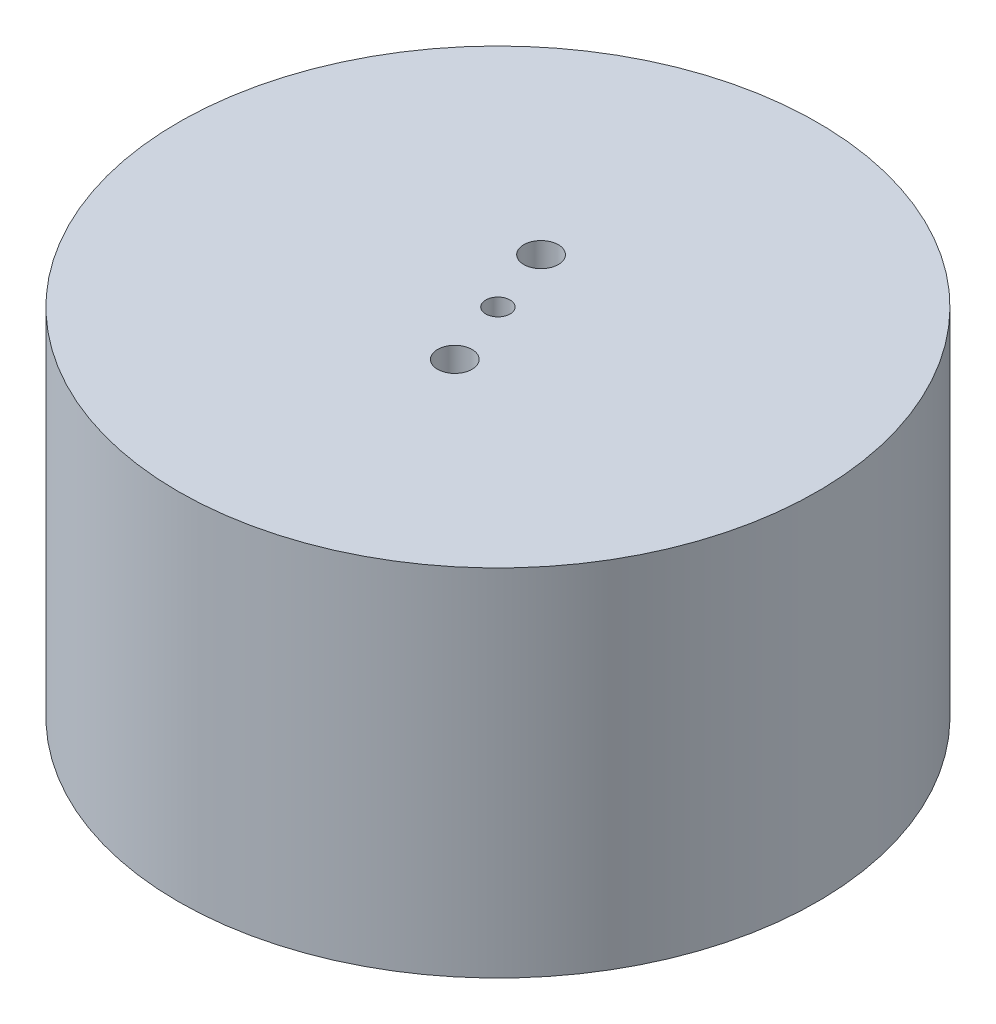
from build123d import *

# Parameters (mm, degrees)
SKETCH4_R                = 31.5
BOSS_EXTRUDE2_DEPTH      = 35
SKETCH3_R                = 26.5
CUT_EXTRUDE1_DEPTH       = 28
M3_CLEARANCE_HOLE1_D     = 3.4
M3_CLEARANCE_HOLE1_DEPTH = 50
M3_CLEARANCE_HOLE1_TIP   = 1.021463052
SKETCH10_R               = 1.2
CUT_EXTRUDE2_DEPTH       = 10


with BuildPart() as part:
    # Sketch4 → Boss-Extrude2 (new body)
    with BuildSketch(Plane(origin=(0, 0, 0), x_dir=(1, 0, 0), z_dir=(0, 1, 0))):
        Circle(SKETCH4_R)
    extrude(amount=BOSS_EXTRUDE2_DEPTH)

    # Sketch3 → Cut-Extrude1 (cut)
    with BuildSketch(Plane(origin=(0, 0, 0), x_dir=(1, 0, 0), z_dir=(0, 1, 0))):
        Circle(SKETCH3_R)
    extrude(amount=CUT_EXTRUDE1_DEPTH, mode=Mode.SUBTRACT)

    # M3 Clearance Hole1
    with Locations(Plane(origin=(0, 35, 0), x_dir=(1, 0, 0), z_dir=(0, 1, 0))):
        with Locations((-2.345047045, 6.595510166), (2.345047045, -6.595510166)):
            Hole(M3_CLEARANCE_HOLE1_D / 2, depth=M3_CLEARANCE_HOLE1_DEPTH)
            with Locations((0, 0, -(M3_CLEARANCE_HOLE1_DEPTH + M3_CLEARANCE_HOLE1_TIP / 2))):  # 118° drill point
                Cone(0, M3_CLEARANCE_HOLE1_D / 2, M3_CLEARANCE_HOLE1_TIP, mode=Mode.SUBTRACT)

    # Sketch10 → Cut-Extrude2 (cut)
    with BuildSketch(Plane(origin=(0, 35, 0), x_dir=(1, 0, 0), z_dir=(0, 1, 0))):
        Circle(SKETCH10_R)
    extrude(amount=-CUT_EXTRUDE2_DEPTH, mode=Mode.SUBTRACT)


solid = part.part
